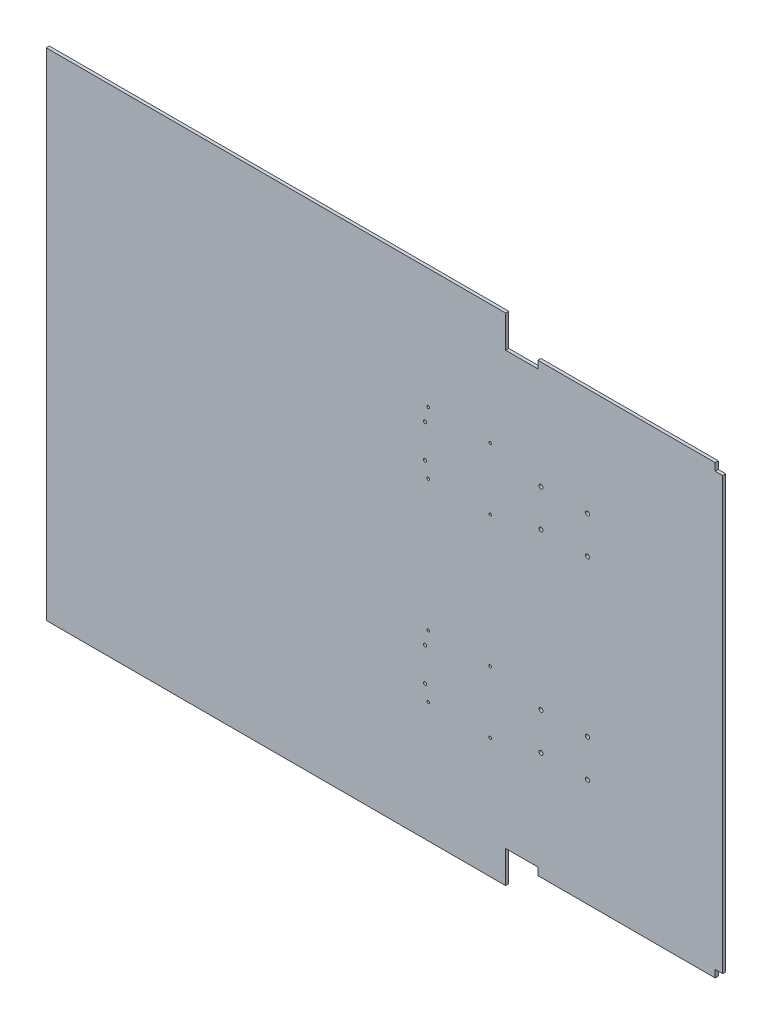
from build123d import *

# Parameters (mm, degrees)
LINEAR_AUSTRAGEN1_DEPTH         = 5
M5X0_8_GEWINDEKERNLOCH1_D       = 4.2
M5X0_8_GEWINDEKERNLOCH1_DEPTH   = 14
M5X0_8_GEWINDEKERNLOCH1_TIP     = 1.2618073
SKIZZE5_R                       = 2.5
SCHNITT_LINEAR_AUSTRAGEN1_DEPTH = 825.102693843
LINEARES_MUSTER1_COUNT          = 2
LINEARES_MUSTER1_PITCH          = 60
LINEARES_MUSTER1_COUNT_DIR2     = 2
LINEARES_MUSTER1_PITCH_DIR2     = 75


with BuildPart() as part:
    # Skizze1 → Linear austragen1 (new body)
    with BuildSketch(Plane.XY):
        Polygon((-370.5, 400), (370.5, 400), (370.5, 348), (422.5, 348), (422.5, 360), (708.5, 360), (708.5, 348), (720.5, 348), (720.5, -348), (708.5, -348), (708.5, -360), (422.5, -360), (422.5, -348), (370.5, -348), (370.5, -400), (-370.5, -400), align=None)
    extrude(amount=LINEAR_AUSTRAGEN1_DEPTH)

    # M5x0.8 Gewindekernloch1
    with Locations(Plane(origin=(345.5, 206, 5), x_dir=(1, 0, 0), z_dir=(0, 0, 1))):
        with Locations((0, 0), (-100, 0), (-100, -100), (0, -100), (0, -312), (-100, -312), (0, -412), (-100, -412)):
            Hole(M5X0_8_GEWINDEKERNLOCH1_D / 2, depth=M5X0_8_GEWINDEKERNLOCH1_DEPTH)
            with Locations((0, 0, -(M5X0_8_GEWINDEKERNLOCH1_DEPTH + M5X0_8_GEWINDEKERNLOCH1_TIP / 2))):  # 118° drill point
                Cone(0, M5X0_8_GEWINDEKERNLOCH1_D / 2, M5X0_8_GEWINDEKERNLOCH1_TIP, mode=Mode.SUBTRACT)

    # Skizze5 → Schnitt-Linear austragen1 (cut, through all)
    with BuildSketch(Plane.XY.offset(5)):
        with Locations((240.5, 183)):
            Circle(SKIZZE5_R)
        with Locations((240.5, 129.152)):
            Circle(SKIZZE5_R)
        with Locations((240.5, -128.952)):
            Circle(SKIZZE5_R)
        with Locations((240.5, -182.8)):
            Circle(SKIZZE5_R)
    extrude(amount=-SCHNITT_LINEAR_AUSTRAGEN1_DEPTH, mode=Mode.SUBTRACT)

    # Skizze8 → Ø6.5 (6.5) Durchmesser Bohrung1 (revolve, cut)
    with BuildSketch(Plane(origin=(427.5, 186, 5), x_dir=(0, -1, 0), z_dir=(1, 0, 0))):
        Polygon((0, 0), (0, 21.952797012), (3.25, 20), (3.25, 0), align=None)
    f_6_5_6_5_durchmesser_bohrung1 = revolve(axis=Axis((427.5, 186, 11.35), (0, 0, -1)), mode=Mode.SUBTRACT)

    # Lineares Muster1: 6.5 _6.5_ Durchmesser Bohrung1 2 × 2
    with Locations(*[(j * LINEARES_MUSTER1_PITCH_DIR2, -i * LINEARES_MUSTER1_PITCH, 0) for i in range(LINEARES_MUSTER1_COUNT) for j in range(LINEARES_MUSTER1_COUNT_DIR2) if (i, j) != (0, 0)]):
        add(f_6_5_6_5_durchmesser_bohrung1, mode=Mode.SUBTRACT)

    # Spiegeln1: Ø6.5 (6.5) Durchmesser Bohrung1 across plane
    add(f_6_5_6_5_durchmesser_bohrung1.mirror(Plane.ZX), mode=Mode.SUBTRACT)

    # Spiegeln1 copy 1 sketch → Spiegeln1 copy 1 (revolve, cut)
    with BuildSketch(Plane(origin=(502.5, -186, 5), x_dir=(0, 1, 0), z_dir=(1, 0, 0))):
        Polygon((0, 0), (0, -21.952797012), (3.25, -20), (3.25, 0), align=None)
    revolve(axis=Axis((502.5, -186, 11.35), (0, 0, 1)), mode=Mode.SUBTRACT)

    # Spiegeln1 copy 2 sketch → Spiegeln1 copy 2 (revolve, cut)
    with BuildSketch(Plane(origin=(427.5, -126, 5), x_dir=(0, 1, 0), z_dir=(1, 0, 0))):
        Polygon((0, 0), (0, -21.952797012), (3.25, -20), (3.25, 0), align=None)
    revolve(axis=Axis((427.5, -126, 11.35), (0, 0, 1)), mode=Mode.SUBTRACT)

    # Spiegeln1 copy 3 sketch → Spiegeln1 copy 3 (revolve, cut)
    with BuildSketch(Plane(origin=(502.5, -126, 5), x_dir=(0, 1, 0), z_dir=(1, 0, 0))):
        Polygon((0, 0), (0, -21.952797012), (3.25, -20), (3.25, 0), align=None)
    revolve(axis=Axis((502.5, -126, 11.35), (0, 0, 1)), mode=Mode.SUBTRACT)


solid = part.part
